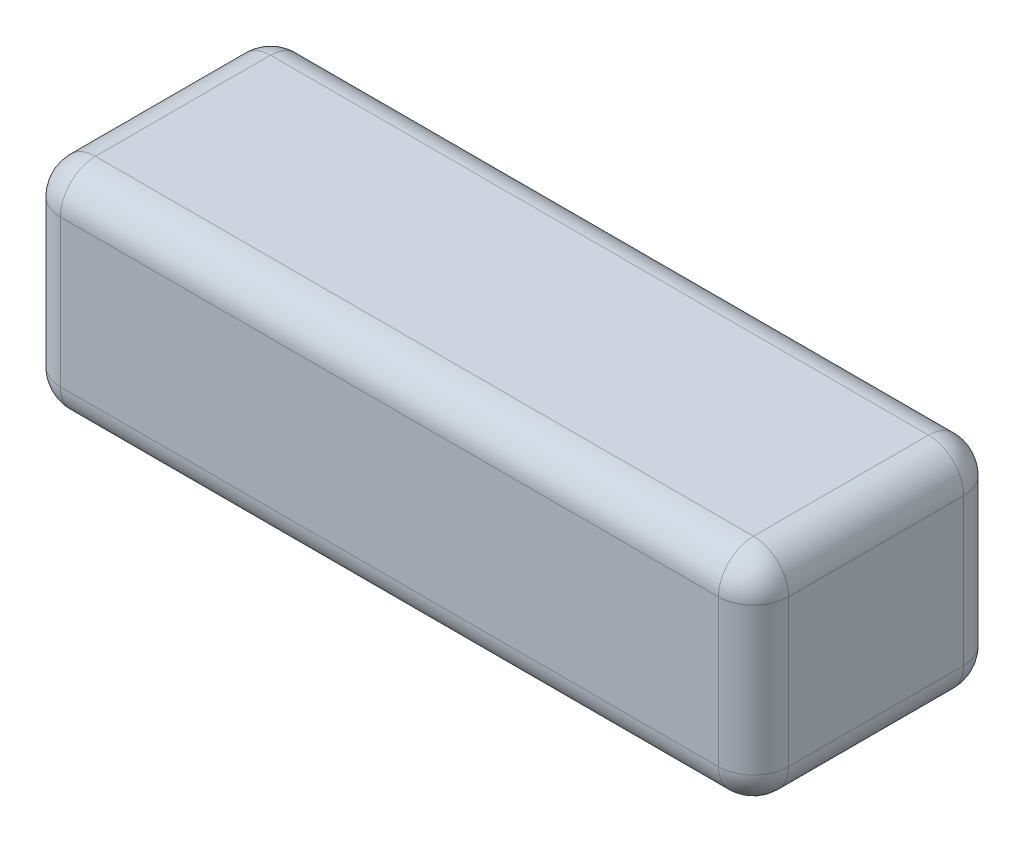
from build123d import *

# Parameters (mm, degrees)
SKETCH1_W           = 103.95
SKETCH1_H           = 35
BOSS_EXTRUDE1_DEPTH = 31
FILLET1_R           = 5


with BuildPart() as part:
    # Sketch1 → Boss-Extrude1 (new body)
    with BuildSketch(Plane(origin=(0, 0, 0), x_dir=(1, 0, 0), z_dir=(0, 1, 0))):
        Rectangle(SKETCH1_W, SKETCH1_H)
    extrude(amount=BOSS_EXTRUDE1_DEPTH)

    # Fillet1
    fillet1_edges = [part.edges().sort_by_distance(p)[0] for p in [
        (-51.975, 0, 0),
        (51.975, 0, 0),
        (51.975, 15.5, -17.5),
        (-51.975, 15.5, -17.5),
        (0, 0, -17.5),
        (-51.975, 15.5, 17.5),
        (51.975, 15.5, 17.5),
        (0, 0, 17.5),
        (0, 31, 17.5),
        (-51.975, 31, 0),
        (0, 31, -17.5),
        (51.975, 31, 0),
    ]]
    fillet(fillet1_edges, radius=FILLET1_R)


solid = part.part
